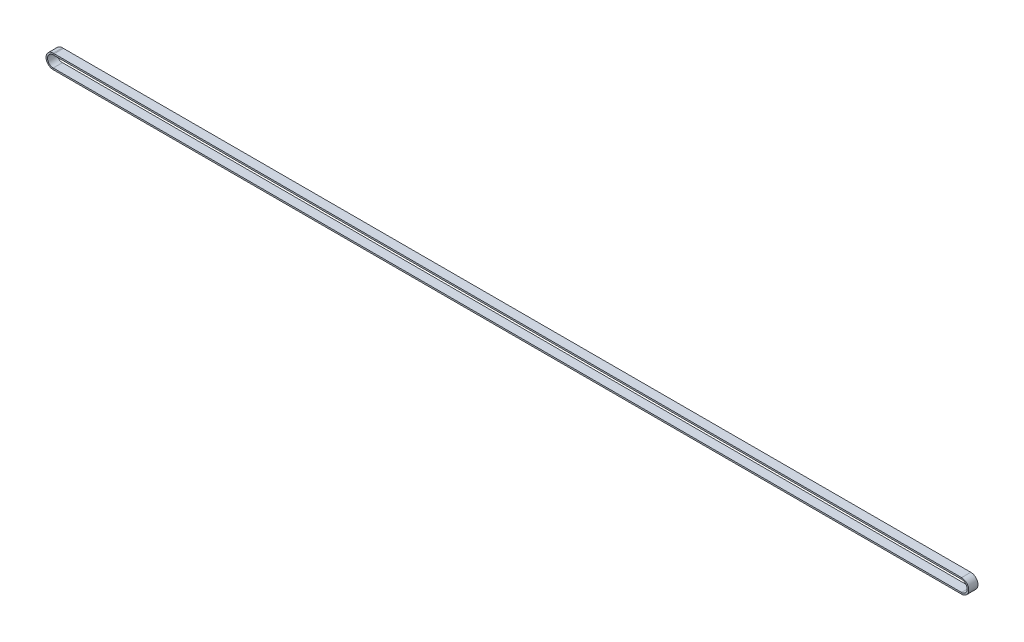
from build123d import *

# Parameters (mm, degrees)
SKETCH3_W = 9
SKETCH3_H = 1.5


with BuildPart() as part:
    # Sweep1: sweep along a path in Sketch2
    with BuildLine(Plane.XY) as sweep1_path:
        Line((-1, -106.87586255), (883.520355785, -106.87586255))
        ThreePointArc((883.520355785, -106.87586255), (890.520355785, -113.87586255), (883.520355785, -120.87586255))
        Line((883.520355785, -120.87586255), (-1, -120.87586255))
        ThreePointArc((-1, -120.87586255), (-8, -113.87586255), (-1, -106.87586255))
    # Sketch3 → Sweep1 (sweep)
    with BuildSketch(Plane(origin=(0, 0, 0), x_dir=(0, 0, -1), z_dir=(1, 0, 0))):
        with Locations((-4.5, -107.62586255)):
            Rectangle(SKETCH3_W, SKETCH3_H)
    sweep(path=sweep1_path.line)


solid = part.part
